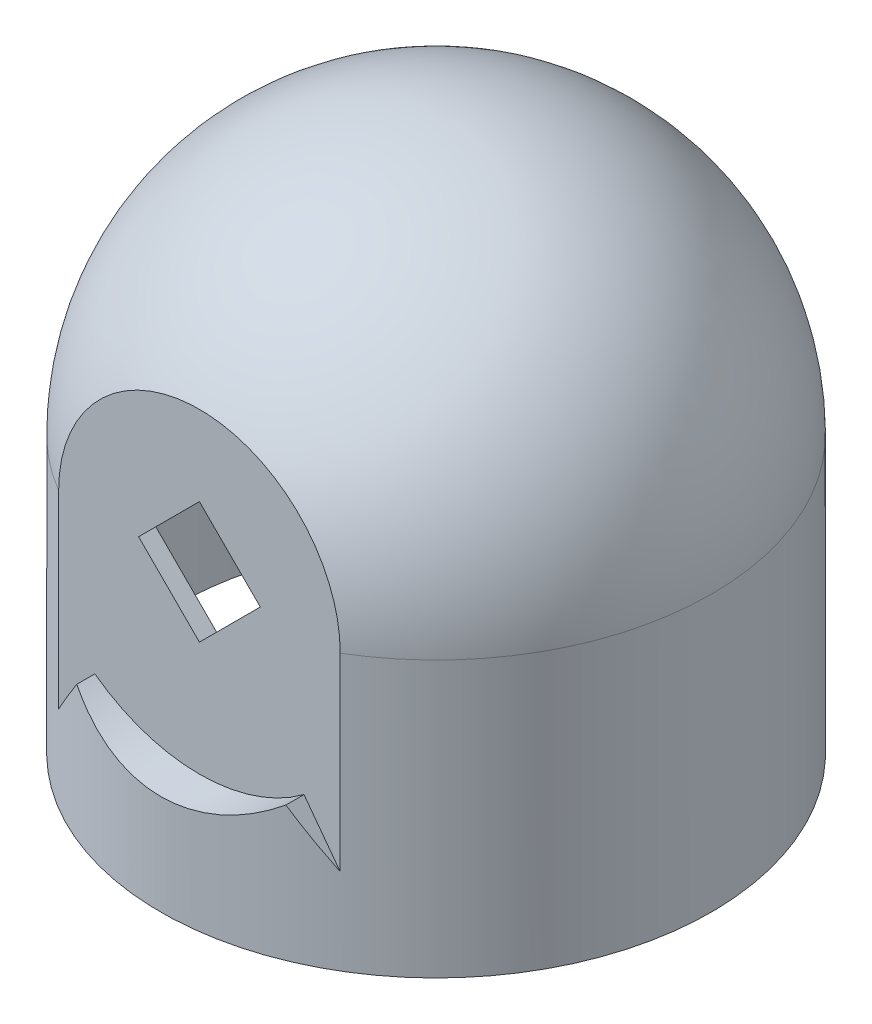
from build123d import *

# Parameters (mm, degrees)
REVOLVE1_ANGLE           = 180
CUT_EXTRUDE1_DEPTH       = 39.328351126
SHELL1_DEPTH             = 16
SHELL1_2_DEPTH           = 4
EXTRUDE1_REACH           = 40.328
EXTRUDE1_END_RADIUS      = 16
CUT_EXTRUDE2_REACH       = 40.328
EXTRUDE_THIN1_REACH      = 53.192
EXTRUDE_THIN1_END_RADIUS = 15
EXTRUDE_THIN1_START      = -12
SKETCH5_R                = 5.5
SKETCH5_R_2              = 4.5


with BuildPart() as part:
    # Sketch1 → Revolve1 (revolve)
    with BuildSketch(Plane(origin=(0, 0, 0), x_dir=(-1, 0, 0), z_dir=(0, 0, -1))):
        with BuildLine():
            Line((0, 0), (16, 0))
            Line((16, 0), (16, 16))
            ThreePointArc((16, 16), (11.313708499, 27.313708499), (0, 32))
            Line((0, 32), (0, 0))
        make_face()
    revolve(axis=Axis((0, 0, 0), (0, 1, 0)), revolution_arc=REVOLVE1_ANGLE)

    # Sketch2 → Cut-Extrude1 (cut, through all)
    with BuildSketch(Plane.XY.offset(13.75)):
        with BuildLine():
            Line((8.181534086, 5), (8.181534086, 16))
            ThreePointArc((8.181534086, 16), (0, 24.181534086), (-8.181534086, 16))
            Line((-8.181534086, 16), (-8.181534086, 5))
            Line((-8.181534086, 5), (8.181534086, 5))
        make_face()
    extrude(amount=CUT_EXTRUDE1_DEPTH, mode=Mode.SUBTRACT)

    # Shell1: read off the stored shape, not the designer's step
    # Shell1 outline → Shell1 (cut)
    with BuildSketch(Plane(origin=(0, 0, 0), x_dir=(1, 0, 0), z_dir=(0, 1, 0))):
        with BuildLine():
            ThreePointArc((7.901740315, -12.75), (13.105840391, -7.296365372), (15, 0))
            Line((15, 0), (-15, 0))
            ThreePointArc((-15, 0), (-13.105840391, -7.296365372), (-7.901740315, -12.75))
            Line((-7.901740315, -12.75), (7.901740315, -12.75))
        make_face()
    extrude(amount=SHELL1_DEPTH, mode=Mode.SUBTRACT)

    # Shell1 2 outline → Shell1 2 (cut)
    with BuildSketch(Plane(origin=(0, 0, 0), x_dir=(1, 0, 0), z_dir=(0, 1, 0))):
        with BuildLine():
            ThreePointArc((-7.901740315, -12.75), (0, -15), (7.901740315, -12.75))
            Line((7.901740315, -12.75), (-7.901740315, -12.75))
        make_face()
    extrude(amount=SHELL1_2_DEPTH, mode=Mode.SUBTRACT)

    # Shell1 3 outline → Shell1 3 (revolve, cut)
    with BuildSketch(Plane.XZ.offset(-16)):
        with BuildLine():
            ThreePointArc((15, 0), (13.105840391, 7.296365372), (7.901740315, 12.75))
            Line((7.901740315, 12.75), (0, 12.75))
            Line((0, 12.75), (0, 0))
            Line((0, 0), (15, 0))
        make_face()
    revolve(axis=Axis((0, 16, 0), (0, 0, 1)), mode=Mode.SUBTRACT)

    # Extrude1: up to this cylinder (the profile starts inside it)
    extrude1_end = Plane(origin=(0, 6.31611, 0), z_dir=(0, -1, 0)) * Cylinder(EXTRUDE1_END_RADIUS, 113.656, mode=Mode.PRIVATE)
    # Sketch3 → Extrude1 (add, up to the surface)
    with BuildSketch(Plane.XY.offset(13.75), mode=Mode.PRIVATE) as extrude1_sk1:
        with BuildLine():
            Line((6.076328446, 7.830430308), (8.181534086, 5))
            Line((8.181534086, 5), (-8.181534086, 5))
            Line((-8.181534086, 5), (-6.076328446, 7.830430308))
            ThreePointArc((-6.076328446, 7.830430308), (0, 5.818465914), (6.076328446, 7.830430308))
        make_face()
    extrude1_tool1 = extrude(extrude1_sk1.sketch, amount=EXTRUDE1_REACH, mode=Mode.PRIVATE) & extrude1_end
    add(extrude1_tool1.solids().sort_by_distance((6.995686, 6.31611, 13.75))[0])

    # Sketch4 → Cut-Extrude2 (cut, up to next)
    with BuildSketch(Plane.XY.offset(13.75), mode=Mode.PRIVATE) as cut_extrude2_sk1:
        Polygon((-3.535533906, 16), (0, 12.464466094), (3.535533906, 16), (0, 19.535533906), align=None)
    cut_extrude2_tool1 = extrude(cut_extrude2_sk1.sketch, amount=-CUT_EXTRUDE2_REACH, mode=Mode.PRIVATE) & part.part
    add(cut_extrude2_tool1.solids().sort_by_distance((0, 16, 13.75))[0], mode=Mode.SUBTRACT)

    # Mirror1: part across face


with BuildPart() as part_1:
    add(part.part)
    add(part.part.mirror(Plane(origin=(0, 18.784156894, 0), x_dir=(1, 0, 0), z_dir=(0, 0, -1))))

    # Extrude-Thin1: up to this sphere (the profile starts inside it)
    extrude_thin1_end = Location((0, 16, 0)) * Sphere(EXTRUDE_THIN1_END_RADIUS, mode=Mode.PRIVATE)
    # Sketch5 → Extrude-Thin1 (add, up to the surface)
    with BuildSketch(Plane.XZ.offset(EXTRUDE_THIN1_START), mode=Mode.PRIVATE) as extrude_thin1_sk1:
        Circle(SKETCH5_R)
        Circle(SKETCH5_R_2, mode=Mode.SUBTRACT)
    extrude_thin1_tool1 = extrude(extrude_thin1_sk1.sketch, amount=-EXTRUDE_THIN1_REACH, mode=Mode.PRIVATE) & extrude_thin1_end
    add(extrude_thin1_tool1.solids().sort_by_distance((-5.344437, 12, 0))[0])


solid = part_1.part
